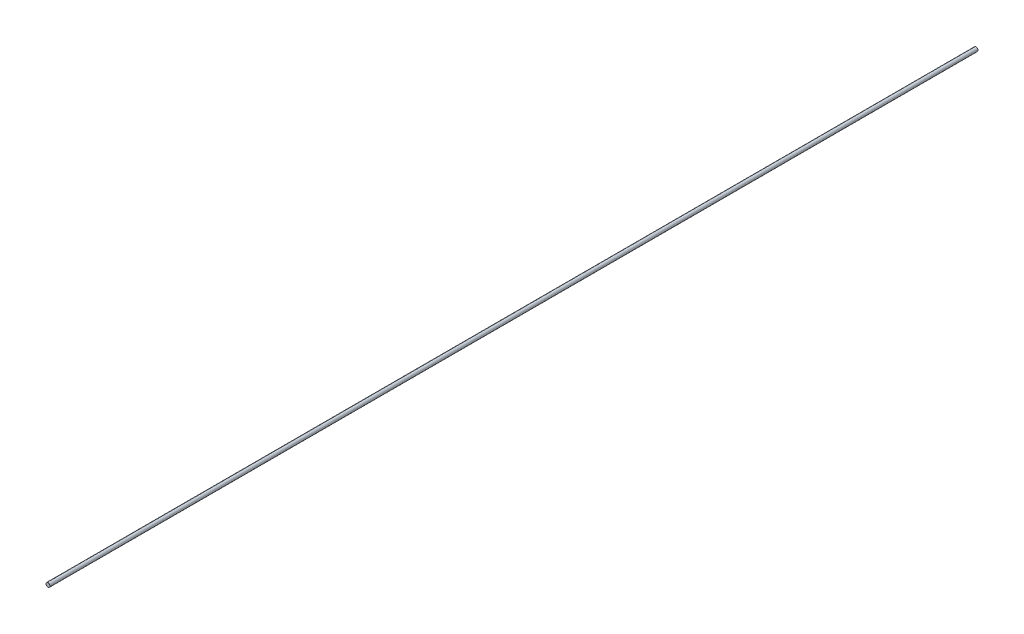
from build123d import *

# Parameters (mm, degrees)
ESQUISSE1_R        = 1.5
BOSS_EXTRU_1_DEPTH = 700


with BuildPart() as part:
    # Esquisse1 → Boss.-Extru.1 (new body)
    with BuildSketch(Plane.XY):
        Circle(ESQUISSE1_R)
    extrude(amount=BOSS_EXTRU_1_DEPTH)


solid = part.part
